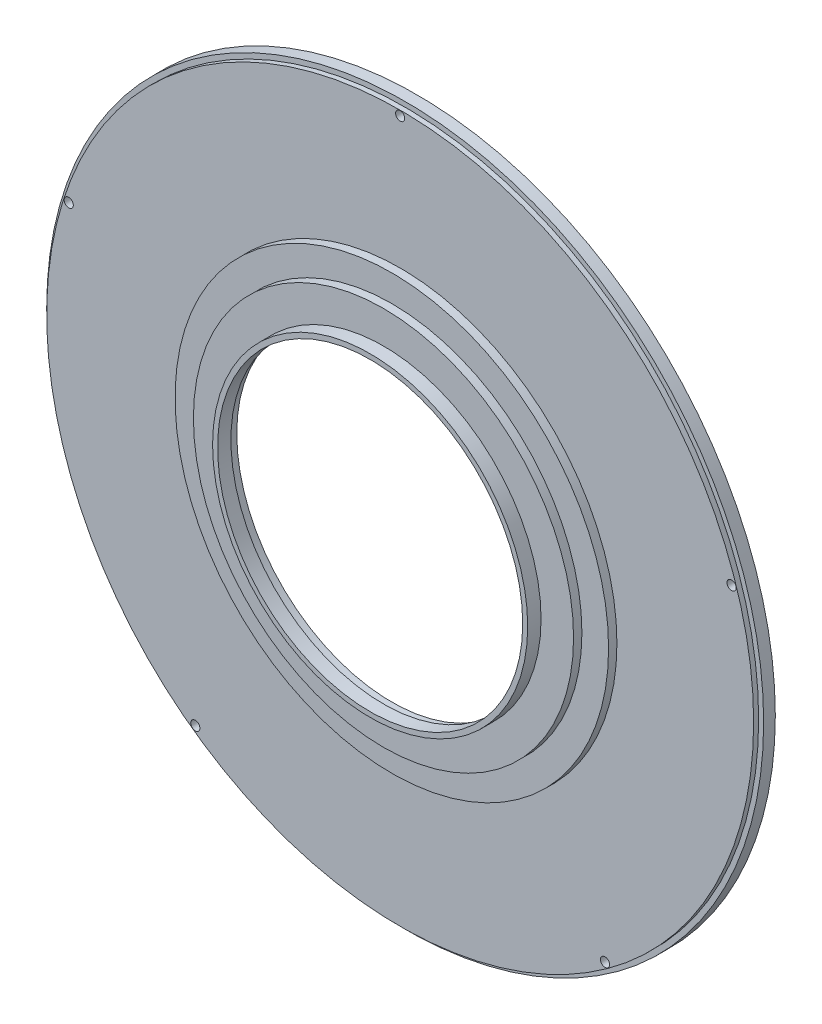
from build123d import *

# Parameters (mm, degrees)
SKETCH1_R         = 215
SKETCH1_R_2       = 120
PLATE_DEPTH       = 10
SKETCH2_R         = 130
SKETCH2_R_2       = 111
BELLMOUTH1_DEPTH  = 5
SKETCH3_R         = 114
SKETCH3_R_2       = 93
BELLMOUTH2_DEPTH  = 5
SKETCH4_R         = 94.5
SKETCH4_R_2       = 91.5
BELLMOUTH3_DEPTH  = 8
SKETCH5_R         = 204
SKETCH5_R_2       = 144
COMB_GROOVE_DEPTH = 4
SKETCH6_R         = 216
SKETCH6_R_2       = 212
BAND_RABBET_DEPTH = 3
SKETCH7_R         = 2.75
ROD_HOLES_DEPTH   = 10


with BuildPart() as part:
    # Sketch1 → Plate (new body)
    with BuildSketch(Plane.XY):
        Circle(SKETCH1_R)
        Circle(SKETCH1_R_2, mode=Mode.SUBTRACT)
    extrude(amount=PLATE_DEPTH)

    # Sketch2 → Bellmouth1 (add)
    with BuildSketch(Plane.XY.offset(10)):
        Circle(SKETCH2_R)
        Circle(SKETCH2_R_2, mode=Mode.SUBTRACT)
    extrude(amount=BELLMOUTH1_DEPTH)

    # Sketch3 → Bellmouth2 (add)
    with BuildSketch(Plane.XY.offset(15)):
        Circle(SKETCH3_R)
        Circle(SKETCH3_R_2, mode=Mode.SUBTRACT)
    extrude(amount=BELLMOUTH2_DEPTH)

    # Sketch4 → Bellmouth3 (add)
    with BuildSketch(Plane.XY.offset(20)):
        Circle(SKETCH4_R)
        Circle(SKETCH4_R_2, mode=Mode.SUBTRACT)
    extrude(amount=BELLMOUTH3_DEPTH)

    # Sketch5 → Comb_groove (cut)
    with BuildSketch(Plane.XY):
        Circle(SKETCH5_R)
        Circle(SKETCH5_R_2, mode=Mode.SUBTRACT)
    extrude(amount=COMB_GROOVE_DEPTH, mode=Mode.SUBTRACT)

    # Sketch6 → Band_rabbet (cut)
    with BuildSketch(Plane.XY.offset(7)):
        Circle(SKETCH6_R)
        Circle(SKETCH6_R_2, mode=Mode.SUBTRACT)
    extrude(amount=BAND_RABBET_DEPTH, mode=Mode.SUBTRACT)

    # Sketch7 → Rod_holes (cut)
    with BuildSketch(Plane.XY):
        with Locations((198.770811906, 64.584551824)):
            Circle(SKETCH7_R)
        with Locations((0, 209)):
            Circle(SKETCH7_R)
        with Locations((-198.770811906, 64.584551824)):
            Circle(SKETCH7_R)
        with Locations((-122.847117729, -169.084551824)):
            Circle(SKETCH7_R)
        with Locations((122.847117729, -169.084551824)):
            Circle(SKETCH7_R)
    extrude(amount=ROD_HOLES_DEPTH, mode=Mode.SUBTRACT)


solid = part.part
